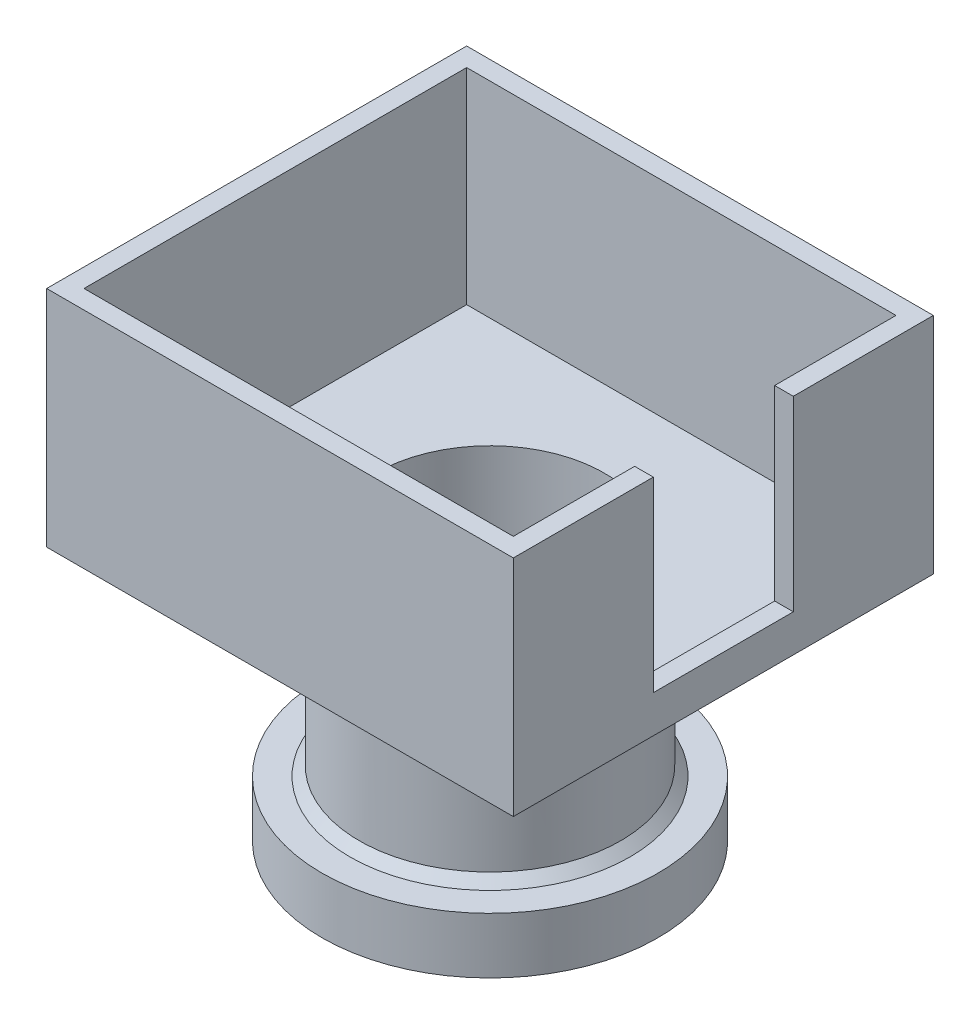
from build123d import *

# Parameters (mm, degrees)
SKETCH1_R           = 18
BOSS_EXTRUDE1_DEPTH = 5
SKETCH2_R           = 14
SKETCH2_R_2         = 12.25
BOSS_EXTRUDE2_DEPTH = 21
SKETCH3_R           = 18
SKETCH3_R_2         = 12.25
BOSS_EXTRUDE3_DEPTH = 1
CHAMFER1_SIZE       = 1
SKETCH4_W           = 50
SKETCH4_H           = 45
SKETCH4_R           = 12.25
BOSS_EXTRUDE4_DEPTH = 2
SKETCH5_W           = 50
SKETCH5_H           = 45
SKETCH5_W_2         = 46
SKETCH5_H_2         = 41
BOSS_EXTRUDE5_DEPTH = 22
CHAMFER2_SIZE       = 5
SKETCH6_W           = 15
SKETCH6_H           = 20
CUT_EXTRUDE1_DEPTH  = 20


with BuildPart() as part:
    # Sketch1 → Boss-Extrude1 (new body)
    with BuildSketch(Plane(origin=(0, 0, 0), x_dir=(1, 0, 0), z_dir=(0, 1, 0))):
        Circle(SKETCH1_R)
        Polygon((8.082903769, -14), (16.165807537, 0), (8.082903769, 14), (-8.082903769, 14), (-16.165807537, 0), (-8.082903769, -14), align=None, mode=Mode.SUBTRACT)
    extrude(amount=BOSS_EXTRUDE1_DEPTH)



with BuildPart() as body_2:
    # Sketch2 → Boss-Extrude2 (new body)
    with BuildSketch(Plane(origin=(0, 5, 0), x_dir=(1, 0, 0), z_dir=(0, 1, 0))):
        Circle(SKETCH2_R)
        Circle(SKETCH2_R_2, mode=Mode.SUBTRACT)
    extrude(amount=BOSS_EXTRUDE2_DEPTH)


with BuildPart() as part_1:
    add(part.part)

    add(body_2.part)  # Boss-Extrude3 merges body 2
    # Sketch3 → Boss-Extrude3 (add)
    with BuildSketch(Plane(origin=(0, 5, 0), x_dir=(1, 0, 0), z_dir=(0, 1, 0))):
        Circle(SKETCH3_R)
        Circle(SKETCH3_R_2, mode=Mode.SUBTRACT)
    extrude(amount=BOSS_EXTRUDE3_DEPTH)

    # Chamfer1
    chamfer1_edges = [part_1.edges().sort_by_distance(p)[0] for p in [
        (-14, 6, 0),
    ]]
    chamfer(chamfer1_edges, length=CHAMFER1_SIZE)

    # Sketch4 → Boss-Extrude4 (add)
    with BuildSketch(Plane(origin=(0, 26, 0), x_dir=(1, 0, 0), z_dir=(0, 1, 0))):
        Rectangle(SKETCH4_W, SKETCH4_H)
        Circle(SKETCH4_R, mode=Mode.SUBTRACT)
    extrude(amount=BOSS_EXTRUDE4_DEPTH)

    # Sketch5 → Boss-Extrude5 (add)
    with BuildSketch(Plane(origin=(0, 28, 0), x_dir=(1, 0, 0), z_dir=(0, 1, 0))):
        Rectangle(SKETCH5_W, SKETCH5_H)
        Rectangle(SKETCH5_W_2, SKETCH5_H_2, mode=Mode.SUBTRACT)
    extrude(amount=BOSS_EXTRUDE5_DEPTH)

    # Chamfer2
    chamfer2_edges = [part_1.edges().sort_by_distance(p)[0] for p in [
        (-14, 26, 0),
    ]]
    chamfer(chamfer2_edges, length=CHAMFER2_SIZE)

    # Sketch6 → Cut-Extrude1 (cut)
    with BuildSketch(Plane(origin=(25, 0, 0), x_dir=(0, 0, -1), z_dir=(1, 0, 0))):
        with Locations((0, 40)):
            Rectangle(SKETCH6_W, SKETCH6_H)
    extrude(amount=-CUT_EXTRUDE1_DEPTH, mode=Mode.SUBTRACT)


solid = part_1.part
